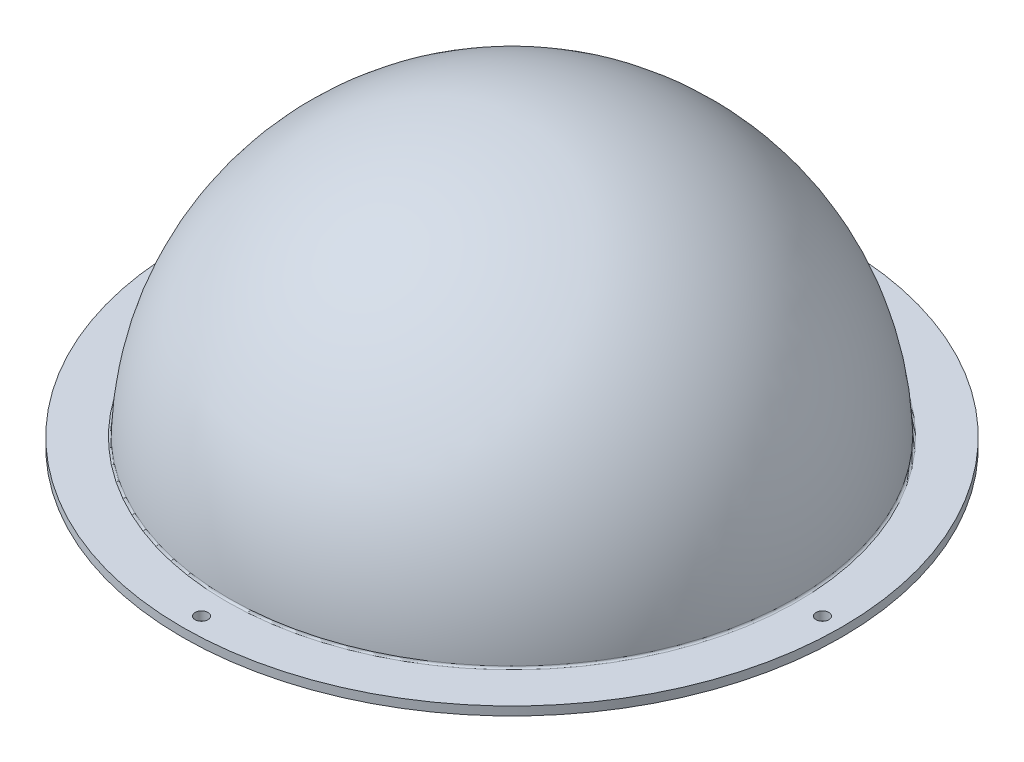
from build123d import *

# Parameters (mm, degrees)
SKETCH2_R        = 1.651
DOME_HOLES_DEPTH = 2.2352
FILLET1_R        = 2.0955
FILLET2_R        = 0.508


# Read off the part's stored shape, not the designer's step: Shell1
with BuildPart() as part:
    # Sketch1 → Revolve1 (revolve)
    with BuildSketch(Plane.XY):
        with BuildLine():
            Line((0, 0), (0, 73.025))
            ThreePointArc((0, 73.025), (50.852351, 52.42273424), (73.025, 2.2352))
            Line((73.025, 2.2352), (84.93125, 2.2352))
            Line((84.93125, 2.2352), (84.93125, 0))
            Line((84.93125, 0), (0, 0))
        make_face()
    revolve(axis=Axis((0, 0, 0), (0, 1, 0)))

    # Shell1 outline → Shell1 (revolve, cut)
    with BuildSketch(Plane.XY):
        with BuildLine():
            Line((0, -7.1e-08), (70.825079619, -7.1e-08))
            ThreePointArc((70.825079619, -7.1e-08), (50.068422427, 50.058086641), (0, 70.7898))
            Line((0, 70.7898), (0, -7.1e-08))
        make_face()
    revolve(axis=Axis((0, 0, 0), (0, 1, 0)), mode=Mode.SUBTRACT)

    # Sketch2 → Dome Holes (cut)
    with BuildSketch(Plane(origin=(0, 2.2352, 0), x_dir=(1, 0, 0), z_dir=(0, 1, 0))):
        with Locations(Location((0, 79.97825, 0), (0, 0, 270))):
            Circle(SKETCH2_R)
        with Locations(Location((79.97825, 0, 0), (0, 0, 270))):
            Circle(SKETCH2_R)
        with Locations(Location((0, -79.97825, 0), (0, 0, 270))):
            Circle(SKETCH2_R)
        with Locations(Location((-79.97825, 0, 0), (0, 0, 270))):
            Circle(SKETCH2_R)
    extrude(amount=-DOME_HOLES_DEPTH, mode=Mode.SUBTRACT)

    # Fillet1
    fillet1_edges = [part.edges().sort_by_distance(p)[0] for p in [
        (-70.825079619, -7.1e-08, 0),
    ]]
    fillet(fillet1_edges, radius=FILLET1_R)

    # Fillet2
    fillet2_edges = [part.edges().sort_by_distance(p)[0] for p in [
        (-73.025, 2.2352, 0),
    ]]
    fillet(fillet2_edges, radius=FILLET2_R)


solid = part.part
